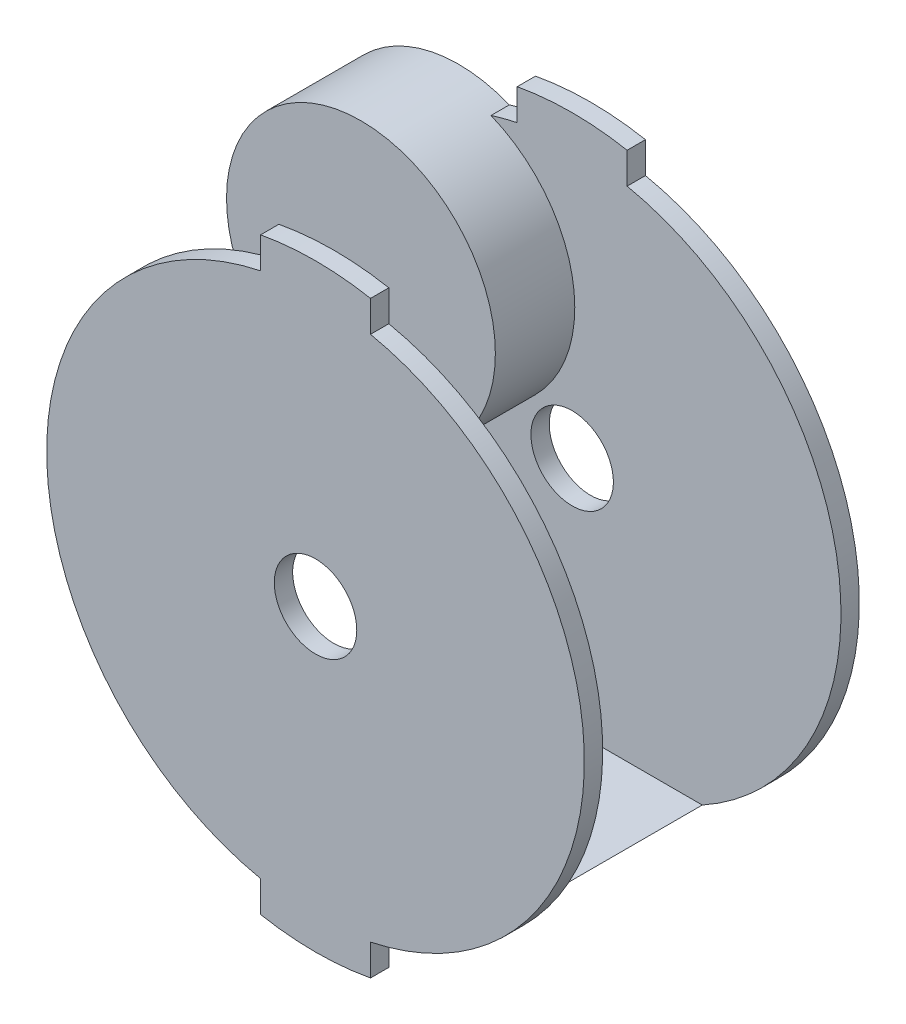
from build123d import *

# Parameters (mm, degrees)
SKETCH1_R               = 1.7145
BOSS_EXTRUDE1_DEPTH     = 11.43
SKETCH2_W               = 9.906
SKETCH2_H               = 2.54
CUT_EXTRUDE1_DEPTH      = 21.259585188
CUT_EXTRUDE1_DEPTH_BACK = 21.259585188
SKETCH4_W               = 9.906
SKETCH4_H               = 20.955
SKETCH4_H_2             = 0.635
SKETCH3_R               = 5.588
BOSS_EXTRUDE2_DEPTH     = 4.064


with BuildPart() as part:
    # Sketch1 → Boss-Extrude1 (new body)
    with BuildSketch(Plane.XY):
        with BuildLine():
            Line((-2.286, 12.234260092), (-2.286, 10.939706577))
            ThreePointArc((-2.286, 10.939706577), (-11.176, 0), (-2.286, -10.939706577))
            Line((-2.286, -10.939706577), (-2.286, -12.234260092))
            ThreePointArc((-2.286, -12.234260092), (0, -12.446), (2.286, -12.234260092))
            Line((2.286, -12.234260092), (2.286, -10.939706577))
            ThreePointArc((2.286, -10.939706577), (11.176, 0), (2.286, 10.939706577))
            Line((2.286, 10.939706577), (2.286, 12.234260092))
            ThreePointArc((2.286, 12.234260092), (0, 12.446), (-2.286, 12.234260092))
        make_face()
        Circle(SKETCH1_R, mode=Mode.SUBTRACT)
    extrude(amount=BOSS_EXTRUDE1_DEPTH)

    # Sketch2 → Cut-Revolve1 (revolve, cut)
    with BuildSketch(Plane(origin=(0, 0, 0), x_dir=(0, 0, -1), z_dir=(1, 0, 0))):
        with Locations((-5.715, 12.446)):
            Rectangle(SKETCH2_W, SKETCH2_H)
    revolve(axis=Axis((0, 0, 11.43), (0, 0, -1)), mode=Mode.SUBTRACT)

    # Sketch4 → Cut-Extrude1 (cut, two sides: drawn at the far end of the back side and taken through both)
    with BuildSketch(Plane(origin=(0, 0, 0), x_dir=(0, 0, -1), z_dir=(1, 0, 0)).offset(-CUT_EXTRUDE1_DEPTH_BACK)):
        with Locations((-5.715, 0.6985)):
            Rectangle(SKETCH4_W, SKETCH4_H)
        with Locations((-5.715, -10.8585)):
            Rectangle(SKETCH4_W, SKETCH4_H_2)
    extrude(amount=CUT_EXTRUDE1_DEPTH + CUT_EXTRUDE1_DEPTH_BACK, mode=Mode.SUBTRACT)

    # Sketch3 → Boss-Extrude2 (add)
    with BuildSketch(Plane.XY):
        with Locations((-5.477956234, 5.477956234)):
            Circle(SKETCH3_R)
    extrude(amount=BOSS_EXTRUDE2_DEPTH)


solid = part.part
